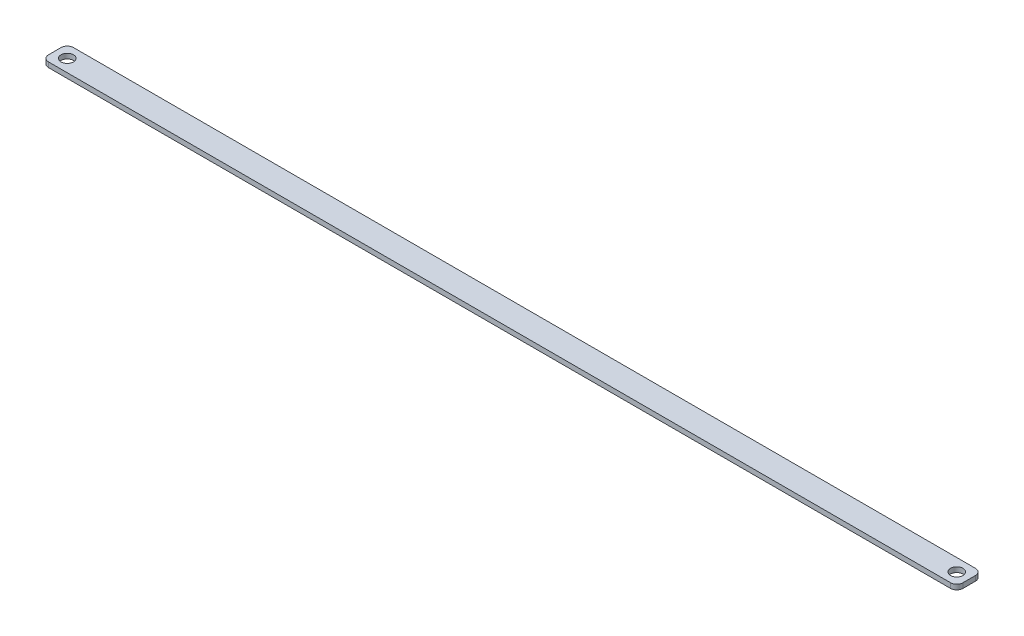
from build123d import *

# Parameters (mm, degrees)
SKETCH1_R           = 2.5
BOSS_EXTRUDE2_DEPTH = 2
FLEX1_OUTLINE_R     = 2.5
FLEX1_DEPTH         = 2


# Read off the part's stored shape, not the designer's step: Flex1
with BuildPart() as part:
    # Sketch1 → Boss-Extrude2 (new body)
    with BuildSketch(Plane(origin=(0, 0, 0), x_dir=(1, 0, 0), z_dir=(0, 1, 0))):
        with BuildLine():
            Line((2.5, 0), (47.5, 0))
            ThreePointArc((47.5, 0), (49.267766953, 0.732233047), (50, 2.5))
            Line((50, 2.5), (50, 7.5))
            ThreePointArc((50, 7.5), (49.267766953, 9.267766953), (47.5, 10))
            Line((47.5, 10), (2.5, 10))
            ThreePointArc((2.5, 10), (0.732233047, 9.267766953), (0, 7.5))
            Line((0, 7.5), (0, 2.5))
            ThreePointArc((0, 2.5), (0.732233047, 0.732233047), (2.5, 0))
        make_face()
        with Locations(Location((5, 5, 0), (0, 0, 270))):
            Circle(SKETCH1_R, mode=Mode.SUBTRACT)
        with Locations(Location((45, 5, 0), (0, 0, 270))):
            Circle(SKETCH1_R, mode=Mode.SUBTRACT)
    extrude(amount=BOSS_EXTRUDE2_DEPTH)

    # Flex1 outline → Flex1 (add)
    # profile 1 of 4: a face of its own
    with BuildSketch(Plane(origin=(0, 0, 0), x_dir=(1, 0, 0), z_dir=(0, 1, 0))):
        with BuildLine():
            Line((2.5, 10), (-152.172258813, 10))
            ThreePointArc((-152.172258813, 10), (-153.940025766, 9.267766953), (-154.672258813, 7.5))
            Line((-154.672258813, 7.5), (-154.672258813, 2.5))
            ThreePointArc((-154.672258813, 2.5), (-153.940025766, 0.732233047), (-152.172258813, 0))
            Line((-152.172258813, 0), (2.5, 0))
            ThreePointArc((2.5, 0), (0.732233047, 0.732233047), (0, 2.5))
            Line((0, 2.5), (0, 7.5))
            ThreePointArc((0, 7.5), (0.732233047, 9.267766953), (2.5, 10))
        make_face()
        with Locations((-149.672258813, 5)):
            Circle(FLEX1_OUTLINE_R, mode=Mode.SUBTRACT)
    # profile 2 of 4: a face of its own
    with BuildSketch(Plane(origin=(0, 0, 0), x_dir=(1, 0, 0), z_dir=(0, 1, 0))):
        with BuildLine():
            Line((209.827741187, 10), (47.5, 10))
            ThreePointArc((47.5, 10), (49.267766953, 9.267766953), (50, 7.5))
            Line((50, 7.5), (50, 2.5))
            ThreePointArc((50, 2.5), (49.267766953, 0.732233047), (47.5, 0))
            Line((47.5, 0), (209.827741187, 0))
            ThreePointArc((209.827741187, 0), (211.59550814, 0.732233047), (212.327741187, 2.5))
            Line((212.327741187, 2.5), (212.327741187, 7.5))
            ThreePointArc((212.327741187, 7.5), (211.59550814, 9.267766953), (209.827741187, 10))
        make_face()
        with Locations((207.327741187, 5)):
            Circle(FLEX1_OUTLINE_R, mode=Mode.SUBTRACT)
    # profile 3 of 4: a face of its own
    with BuildSketch(Plane(origin=(0, 0, 0), x_dir=(1, 0, 0), z_dir=(0, 1, 0))):
        with Locations((5, 5)):
            Circle(FLEX1_OUTLINE_R)
    # profile 4 of 4: a face of its own
    with BuildSketch(Plane(origin=(0, 0, 0), x_dir=(1, 0, 0), z_dir=(0, 1, 0))):
        with Locations((45, 5)):
            Circle(FLEX1_OUTLINE_R)
    extrude(amount=FLEX1_DEPTH)


solid = part.part
